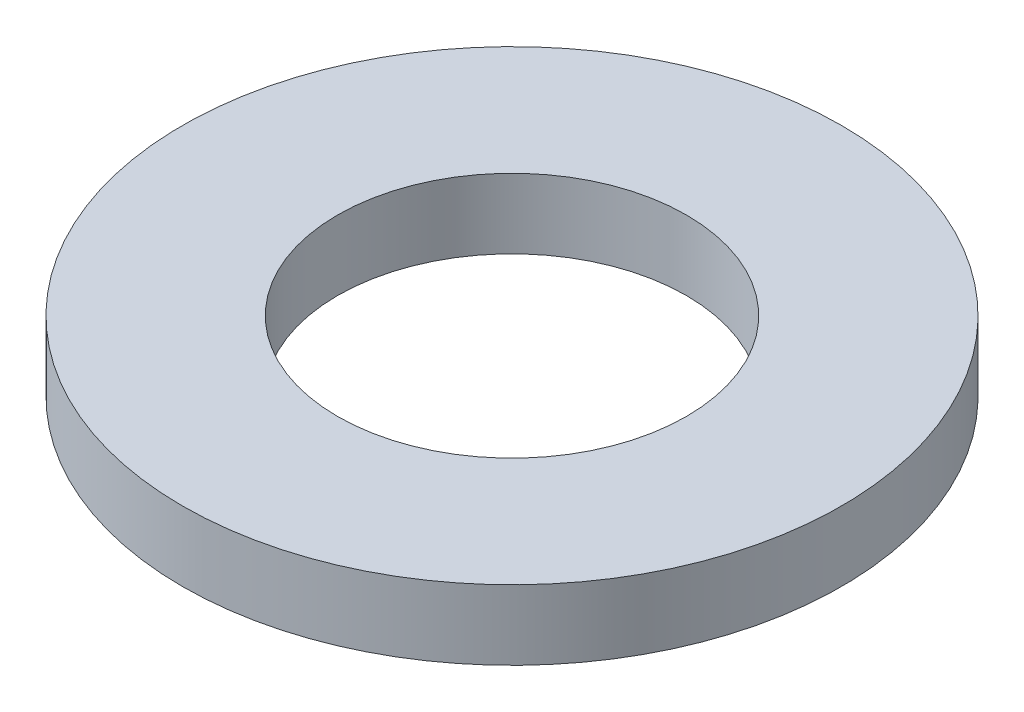
from build123d import *

# Parameters (mm, degrees)
SKETCH1_R           = 85
BOSS_EXTRUDE1_DEPTH = 18
SKETCH2_R           = 45
CUT_EXTRUDE1_DEPTH  = 122.548344291


with BuildPart() as part:
    # Sketch1 → Boss-Extrude1 (new body)
    with BuildSketch(Plane(origin=(0, 0, 0), x_dir=(1, 0, 0), z_dir=(0, 1, 0))):
        Circle(SKETCH1_R)
    extrude(amount=BOSS_EXTRUDE1_DEPTH)

    # Sketch2 → Cut-Extrude1 (cut, through all)
    with BuildSketch(Plane(origin=(0, 0, 0), x_dir=(1, 0, 0), z_dir=(0, 1, 0))):
        Circle(SKETCH2_R)
    extrude(amount=CUT_EXTRUDE1_DEPTH, mode=Mode.SUBTRACT)


solid = part.part
